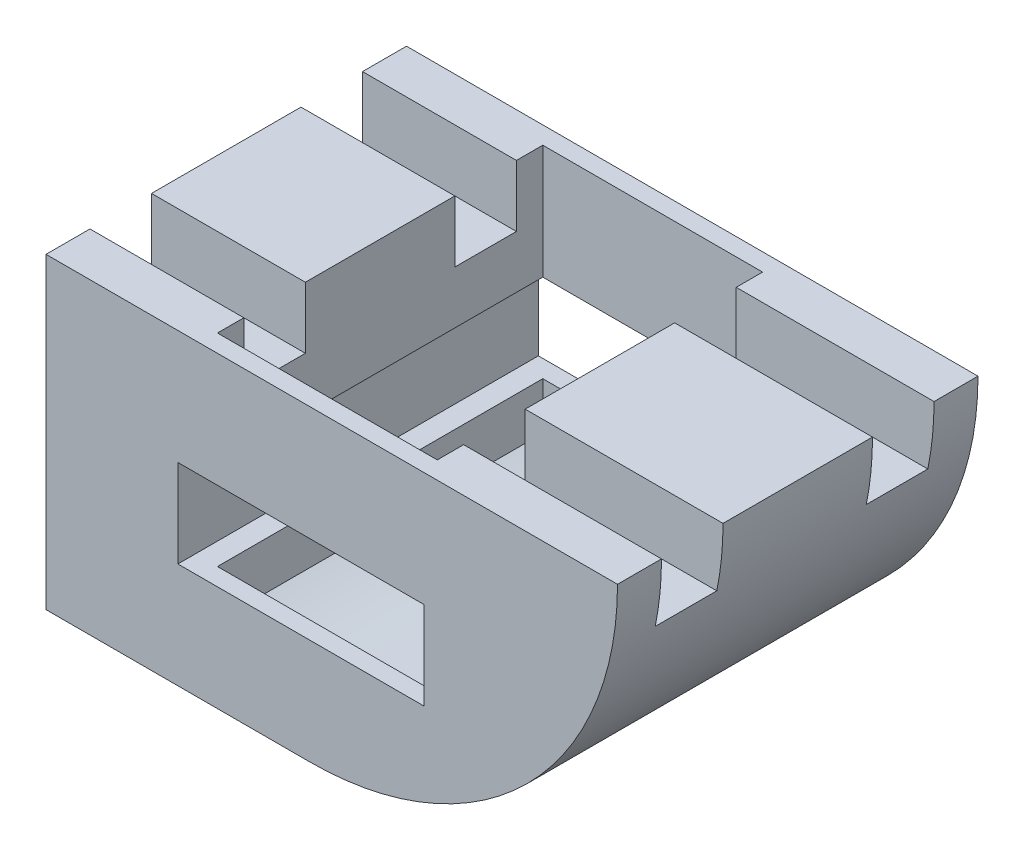
from build123d import *

# Parameters (mm, degrees)
BOSS_EXTRUDE1_DEPTH = 45
SKETCH2_W           = 31
SKETCH2_H           = 37
BOSS_EXTRUDE3_START = -45
BOSS_EXTRUDE3_DEPTH = 45
SKETCH4_R           = 5.05
CUT_EXTRUDE1_DEPTH  = 12
SKETCH5_W           = 5
SKETCH5_H           = 35
CUT_EXTRUDE2_DEPTH  = 67.895440801
BOSS_EXTRUDE5_DEPTH = 37
BOSS_EXTRUDE6_START = 5
SKETCH7_W           = 17.5
SKETCH7_H           = 7.441015215
BOSS_EXTRUDE6_DEPTH = 5
SKETCH9_W           = 15
SKETCH9_H           = 55
SKETCH9_W_2         = 10
BOSS_EXTRUDE7_DEPTH = 3
SKETCH12_R          = 1.55
CUT_EXTRUDE5_DEPTH  = 5
SKETCH13_W          = 7
SKETCH13_H          = 7
CUT_EXTRUDE6_DEPTH  = 90.162772501
SKETCH14_W          = 65
SKETCH14_H          = 3
CUT_EXTRUDE7_DEPTH  = 74.993242935
CUT_EXTRUDE8_DEPTH  = 90.162772501
CUT_EXTRUDE9_DEPTH  = 5
SKETCH17_W          = 28
SKETCH17_H          = 10
CUT_EXTRUDE10_DEPTH = 65.272855857


with BuildPart() as part:
    # Sketch1 → Boss-Extrude1 (new body)
    with BuildSketch(Plane.XY):
        with BuildLine():
            Line((35, 0), (-35, 0))
            ThreePointArc((-35, 0), (0, -35), (35, 0))
        make_face()
    extrude(amount=BOSS_EXTRUDE1_DEPTH)

    # Sketch2 → Cut-Revolve1 (revolve, cut)
    with BuildSketch(Plane(origin=(0, 0, 0), x_dir=(1, 0, 0), z_dir=(0, 1, 0))):
        with Locations((-15.5, -22.5)):
            Rectangle(SKETCH2_W, SKETCH2_H)
    revolve(axis=Axis((0, 0, 0), (0, 0, 1)), mode=Mode.SUBTRACT)

    # Sketch3 → Boss-Extrude3 (add)
    with BuildSketch(Plane.XY.offset(45).offset(BOSS_EXTRUDE3_START)):
        with BuildLine():
            Line((-17.5, -30.310889132), (-17.5, 0))
            Line((-17.5, 0), (-35, 0))
            Line((-35, 0), (-35, -35))
            Line((-35, -35), (0, -35))
            ThreePointArc((0, -35), (-9.058666579, -33.80740392), (-17.5, -30.310889132))
        make_face()
    extrude(amount=BOSS_EXTRUDE3_DEPTH)

    # Sketch4 → Cut-Extrude1 (cut)
    with BuildSketch(Plane.ZY.offset(35)):
        with Locations((10, -17.5)):
            Circle(SKETCH4_R)
        with Locations((35, -17.5)):
            Circle(SKETCH4_R)
    extrude(amount=-CUT_EXTRUDE1_DEPTH, mode=Mode.SUBTRACT)

    # Sketch5 → Cut-Extrude2 (cut, through all)
    with BuildSketch(Plane(origin=(0, 0, 0), x_dir=(-1, 0, 0), z_dir=(0, 0, -1))):
        with Locations((32.5, -17.5)):
            Rectangle(SKETCH5_W, SKETCH5_H)
    extrude(amount=-CUT_EXTRUDE2_DEPTH, mode=Mode.SUBTRACT)

    # Sketch6 → Boss-Extrude5 (add)
    with BuildSketch(Plane(origin=(0, 0, 41), x_dir=(-1, 0, 0), z_dir=(0, 0, -1))):
        with BuildLine():
            ThreePointArc((-31, 0), (-25.966324345, -16.933694222), (-12.5, -28.368115905))
            Line((-12.5, -28.368115905), (-12.5, 0))
            Line((-12.5, 0), (-31, 0))
        make_face()
        with BuildLine():
            Line((12.5, 0), (12.5, -28.368115905))
            ThreePointArc((12.5, -28.368115905), (15.064267175, -27.093686617), (17.5, -25.588083164))
            Line((17.5, -25.588083164), (17.5, 0))
            Line((17.5, 0), (12.5, 0))
        make_face()
    extrude(amount=BOSS_EXTRUDE5_DEPTH)

    # Sketch7 → Boss-Extrude6 (add)
    with BuildSketch(Plane(origin=(0, 0, 0), x_dir=(-1, 0, 0), z_dir=(0, 0, -1)).offset(BOSS_EXTRUDE6_START)):
        with BuildLine():
            Line((-12.5, 0), (-35, 0))
            ThreePointArc((-35, 0), (-34.799393274, -3.741955075), (-34.199872698, -7.441015215))
            Line((-34.199872698, -7.441015215), (-12.5, -7.441015215))
            Line((-12.5, -7.441015215), (-12.5, 0))
        make_face()
        with Locations((21.25, -3.720507608)):
            Rectangle(SKETCH7_W, SKETCH7_H)
    boss_extrude6 = extrude(amount=-BOSS_EXTRUDE6_DEPTH)

    # Mirror1: Boss-Extrude6 across plane
    add(boss_extrude6.mirror(Plane(origin=(0, 0, 22.5), x_dir=(1, 0, 0), z_dir=(0, 0, -1))))

    # Sketch9 → Boss-Extrude7 (add)
    with BuildSketch(Plane(origin=(0, 0, 0), x_dir=(1, 0, 0), z_dir=(0, 1, 0))):
        with Locations((27.5, -22.5)):
            Rectangle(SKETCH9_W, SKETCH9_H)
        with Locations((-25, -22.5)):
            Rectangle(SKETCH9_W_2, SKETCH9_H)
    extrude(amount=BOSS_EXTRUDE7_DEPTH)

    # Sketch12 → Cut-Extrude5 (cut)
    with BuildSketch(Plane(origin=(0, 3, 0), x_dir=(1, 0, 0), z_dir=(0, 1, 0))):
        with Locations((26, 1.5)):
            Circle(SKETCH12_R)
        with Locations((26, -10.5)):
            Circle(SKETCH12_R)
        with Locations((26, -34.5)):
            Circle(SKETCH12_R)
        with Locations((26, -46.5)):
            Circle(SKETCH12_R)
        with Locations((-26, 1.5)):
            Circle(SKETCH12_R)
        with Locations((-26, -10.5)):
            Circle(SKETCH12_R)
        with Locations((-26, -34.5)):
            Circle(SKETCH12_R)
        with Locations((-26, -46.5)):
            Circle(SKETCH12_R)
    extrude(amount=-CUT_EXTRUDE5_DEPTH, mode=Mode.SUBTRACT)

    # Sketch13 → Cut-Extrude6 (cut, through all)
    with BuildSketch(Plane(origin=(35, 0, 0), x_dir=(0, 0, -1), z_dir=(1, 0, 0))):
        with Locations((-46.5, -3.5)):
            Rectangle(SKETCH13_W, SKETCH13_H)
        with Locations((-34.5, -3.5)):
            Rectangle(SKETCH13_W, SKETCH13_H)
        with Locations((-10.5, -3.5)):
            Rectangle(SKETCH13_W, SKETCH13_H)
        with Locations((1.5, -3.5)):
            Rectangle(SKETCH13_W, SKETCH13_H)
    extrude(amount=-CUT_EXTRUDE6_DEPTH, mode=Mode.SUBTRACT)

    # Sketch14 → Cut-Extrude7 (cut, through all)
    with BuildSketch(Plane.XY.offset(50)):
        with Locations((2.5, 1.5)):
            Rectangle(SKETCH14_W, SKETCH14_H)
    extrude(amount=-CUT_EXTRUDE7_DEPTH, mode=Mode.SUBTRACT)

    # Sketch15 → Cut-Extrude8 (cut, through all)
    with BuildSketch(Plane.ZY.offset(30)):
        Polygon((43, -7), (43, -35), (45, -35), (45, -7.441015215), (50, -7.441015215), (50, -7), align=None)
        Polygon((-5, -7), (-5, -7.441015215), (0, -7.441015215), (0, -35), (2, -35), (2, -7), align=None)
    extrude(amount=-CUT_EXTRUDE8_DEPTH, mode=Mode.SUBTRACT)

    # Sketch16 → Cut-Extrude9 (cut)
    with BuildSketch(Plane.ZY.offset(30)):
        with BuildLine():
            ThreePointArc((32.952757482, -22.11641615), (30.031456954, -18.403371463), (31.458802518, -13.89966385))
            ThreePointArc((31.458802518, -13.89966385), (24.58065045, -19.394427191), (32.952757482, -22.11641615))
        make_face()
        with BuildLine():
            ThreePointArc((12.047242518, -22.11641615), (20.41934955, -19.394427191), (13.541197482, -13.89966385))
            ThreePointArc((13.541197482, -13.89966385), (14.968543046, -18.403371463), (12.047242518, -22.11641615))
        make_face()
    extrude(amount=-CUT_EXTRUDE9_DEPTH, mode=Mode.SUBTRACT)

    # Sketch17 → Cut-Extrude10 (cut, through all)
    with BuildSketch(Plane.XY.offset(43)):
        with Locations((-1, -18)):
            Rectangle(SKETCH17_W, SKETCH17_H)
    extrude(amount=-CUT_EXTRUDE10_DEPTH, mode=Mode.SUBTRACT)


solid = part.part
